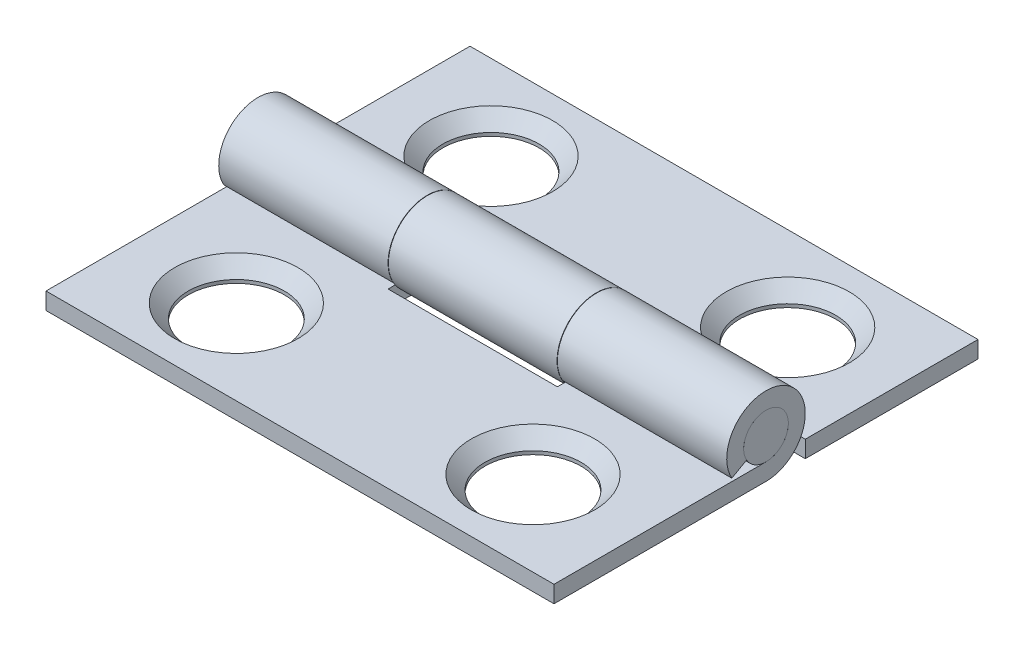
from build123d import *

# Parameters (mm, degrees)
BOSS_EXTRUDE1_DEPTH     = 9.525
CIRPATTERN1_COUNT       = 2
CUT_EXTRUDE1_DEPTH      = 13.494063522
CUT_EXTRUDE1_DEPTH_BACK = 13.494063522
SKETCH4_W               = 6.35
SKETCH4_H               = 2.9464
CUT_EXTRUDE4_DEPTH      = 13.494063522
CUT_EXTRUDE4_DEPTH_BACK = 13.494063522
SKETCH10_W              = 6.3627
SKETCH10_H              = 2.9464
CUT_EXTRUDE3_DEPTH      = 13.494063522
CUT_EXTRUDE3_DEPTH_BACK = 13.494063522
SKETCH9_R               = 1.8034
CUT_EXTRUDE6_DEPTH      = 13.620375391
CUT_EXTRUDE6_DEPTH_BACK = 13.620375391
SKETCH12_R              = 1.8034
SKETCH6_R               = 0.8382
BOSS_EXTRUDE2_DEPTH     = 9.525


with BuildPart() as part:
    # Sketch3 → Boss-Extrude1 (new, symmetric)
    with BuildSketch(Plane(origin=(0, 0, 0), x_dir=(0, 0, -1), z_dir=(1, 0, 0))):
        with BuildLine():
            Line((0, -1.4732), (-7.9502, -1.4732))
            Line((-7.9502, -1.4732), (-7.9502, -0.8382))
            Line((-7.9502, -0.8382), (0, -0.8382))
            ThreePointArc((0, -0.8382), (0.421388638, 0.724576328), (-0.728533124, -0.414510226))
            Line((-0.728533124, -0.414510226), (-1.280452157, -0.728533124))
            ThreePointArc((-1.280452157, -0.728533124), (0.740622455, 1.273497789), (0, -1.4732))
        make_face()
    extrude(amount=BOSS_EXTRUDE1_DEPTH, both=True)


with BuildPart() as cirpattern1_1:
    # CirPattern1: pattern copy
    add(part.part.rotate(Axis((0, 0.8382, 0), (0, -1, 0)), 1 * 360 / CIRPATTERN1_COUNT))

    # Sketch10 → Cut-Extrude4 (cut, two sides: drawn at the far end of the back side and taken through both)
    with BuildSketch(Plane(origin=(0, 0, 0), x_dir=(1, 0, 0), z_dir=(0, 1, 0)).offset(-CUT_EXTRUDE4_DEPTH_BACK)):
        with Locations((-6.34365, 0)):
            Rectangle(SKETCH10_W, SKETCH10_H)
        with Locations((6.34365, 0)):
            Rectangle(SKETCH10_W, SKETCH10_H)
    extrude(amount=CUT_EXTRUDE4_DEPTH + CUT_EXTRUDE4_DEPTH_BACK, mode=Mode.SUBTRACT)

    # Cut-Extrude5 cone 1 section (through the dimple's axis) → Cut-Extrude5 (revolve, cut)
    with BuildSketch(Plane(origin=(5.5626, -0.8382, -4.7752), x_dir=(0, 0, 1), z_dir=(1, 0, 0))):
        Polygon((0, 0), (2.3114, 0), (0, 2.3114), align=None)
    revolve(axis=Axis((5.5626, -0.8382, -4.7752), (0, -1, 0)), mode=Mode.SUBTRACT)

    # Cut-Extrude5 cone 2 section (through the dimple's axis) → Cut-Extrude5 cone 2 (revolve, cut)
    with BuildSketch(Plane(origin=(-5.5626, -0.8382, -4.7752), x_dir=(0, 0, 1), z_dir=(1, 0, 0))):
        Polygon((0, 0), (2.3114, 0), (0, 2.3114), align=None)
    revolve(axis=Axis((-5.5626, -0.8382, -4.7752), (0, -1, 0)), mode=Mode.SUBTRACT)

    # Sketch12 → Cut-Extrude6 (cut, two sides: drawn at the far end of the back side and taken through both)
    with BuildSketch(Plane(origin=(0, -0.8382, 0), x_dir=(1, 0, 0), z_dir=(0, 1, 0)).offset(-CUT_EXTRUDE6_DEPTH_BACK)):
        with Locations((-5.5626, 4.7752)):
            Circle(SKETCH12_R)
        with Locations((5.5626, 4.7752)):
            Circle(SKETCH12_R)
    extrude(amount=CUT_EXTRUDE6_DEPTH + CUT_EXTRUDE6_DEPTH_BACK, mode=Mode.SUBTRACT)


with BuildPart() as part_1:
    add(part.part)

    # Sketch4 → Cut-Extrude1 (cut, two sides: drawn at the far end of the back side and taken through both)
    with BuildSketch(Plane(origin=(0, 0, 0), x_dir=(1, 0, 0), z_dir=(0, 1, 0)).offset(-CUT_EXTRUDE1_DEPTH_BACK)):
        Rectangle(SKETCH4_W, SKETCH4_H)
    extrude(amount=CUT_EXTRUDE1_DEPTH + CUT_EXTRUDE1_DEPTH_BACK, mode=Mode.SUBTRACT)

    # Cut-Extrude2 cone 1 section (through the dimple's axis) → Cut-Extrude2 (revolve, cut)
    with BuildSketch(Plane(origin=(5.5626, -0.8382, 4.7752), x_dir=(0, 0, 1), z_dir=(1, 0, 0))):
        Polygon((0, 0), (2.3114, 0), (0, 2.3114), align=None)
    revolve(axis=Axis((5.5626, -0.8382, 4.7752), (0, -1, 0)), mode=Mode.SUBTRACT)

    # Cut-Extrude2 cone 2 section (through the dimple's axis) → Cut-Extrude2 cone 2 (revolve, cut)
    with BuildSketch(Plane(origin=(-5.5626, -0.8382, 4.7752), x_dir=(0, 0, 1), z_dir=(1, 0, 0))):
        Polygon((0, 0), (2.3114, 0), (0, 2.3114), align=None)
    revolve(axis=Axis((-5.5626, -0.8382, 4.7752), (0, -1, 0)), mode=Mode.SUBTRACT)

    # Sketch9 → Cut-Extrude3 (cut, two sides: drawn at the far end of the back side and taken through both)
    with BuildSketch(Plane(origin=(0, 0, 0), x_dir=(1, 0, 0), z_dir=(0, 1, 0)).offset(-CUT_EXTRUDE3_DEPTH_BACK)):
        with Locations((5.5626, -4.7752)):
            Circle(SKETCH9_R)
        with Locations((-5.5626, -4.7752)):
            Circle(SKETCH9_R)
    extrude(amount=CUT_EXTRUDE3_DEPTH + CUT_EXTRUDE3_DEPTH_BACK, mode=Mode.SUBTRACT)


with BuildPart() as body_3:
    # Sketch6 → Boss-Extrude2 (new, symmetric)
    with BuildSketch(Plane(origin=(0, 0, 0), x_dir=(0, 0, -1), z_dir=(1, 0, 0))):
        Circle(SKETCH6_R)
    extrude(amount=BOSS_EXTRUDE2_DEPTH, both=True)


solid = Compound([cirpattern1_1.part, part_1.part, body_3.part])
